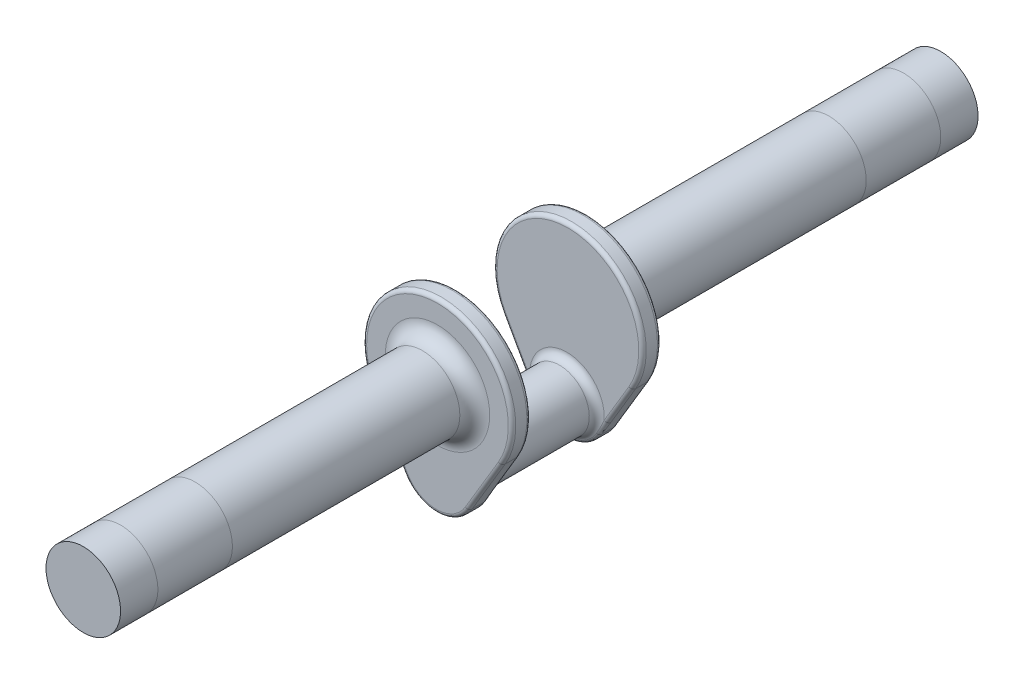
from build123d import *

# Parameters (mm, degrees)
EXTRUDE1_DEPTH = 6.35
SKETCH2_R      = 12.7
EXTRUDE2_DEPTH = 120.65
SKETCH3_R      = 10.16
EXTRUDE4_DEPTH = 19.05
FILLET1_R      = 2.54
FILLET2_R      = 5.08
FILLET3_R      = 1.27


with BuildPart() as part:
    # Sketch1 → Extrude1 (new body)
    with BuildSketch(Plane.XY):
        with BuildLine():
            Line((-22.174672946, -12.387246657), (-11.445580084, -31.593623329))
            ThreePointArc((-11.445580084, -31.593623329), (-0.537347603, -38.098737014), (10.550006681, -31.903850826))
            Line((10.550006681, -31.903850826), (21.816500584, -13.007701651))
            ThreePointArc((21.816500584, -13.007701651), (0.358207984, 25.397474029), (-22.174672946, -12.387246657))
        make_face()
    extrude(amount=EXTRUDE1_DEPTH)

    # Sketch2 → Extrude2 (add)
    with BuildSketch(Plane(origin=(0, 0, 0), x_dir=(-1, 0, 0), z_dir=(0, 0, -1))):
        with Locations(Location((0, 0, 0), (0, 0, 180))):
            Circle(SKETCH2_R)
    extrude(amount=EXTRUDE2_DEPTH)

    # Sketch3 → Extrude4 (add)
    with BuildSketch(Plane.XY.offset(6.35)):
        with Locations(Location((-0.358243611, -25.4, 0), (0, 0, 180))):
            Circle(SKETCH3_R)
    extrude(amount=EXTRUDE4_DEPTH)

    # Fillet1
    fillet1_edges = [part.edges().sort_by_distance(p)[0] for p in [
        (9.801756389, -25.4, 6.35),
    ]]
    fillet(fillet1_edges, radius=FILLET1_R - 0.0001)  # a hair under: the kernel refuses the full size

    # Fillet2
    fillet2_edges = [part.edges().sort_by_distance(p)[0] for p in [
        (-12.7, 0, 0),
    ]]
    fillet(fillet2_edges, radius=FILLET2_R)

    # Fillet3
    fillet3_edges = [part.edges().sort_by_distance(p)[0] for p in [
        (16.183253633, -22.455776239, 6.35),
        (-16.810126515, -21.990434993, 6.35),
        (16.183253633, -22.455776239, 0),
        (-0.537347603, -38.098737014, 0),
        (-16.810126515, -21.990434993, 0),
        (0.358207984, 25.397474029, 6.35),
        (0.358207984, 25.397474029, 0),
        (-0.537347603, -38.098737014, 6.35),
    ]]
    fillet(fillet3_edges, radius=FILLET3_R)

    # Mirror2: part across plane


with BuildPart() as part_1:
    add(part.part)
    add(part.part.mirror(Plane(origin=(-0.358243611, -25.4, 25.4), x_dir=(1, 0, 0), z_dir=(0, 0, 1))))


solid = part_1.part
